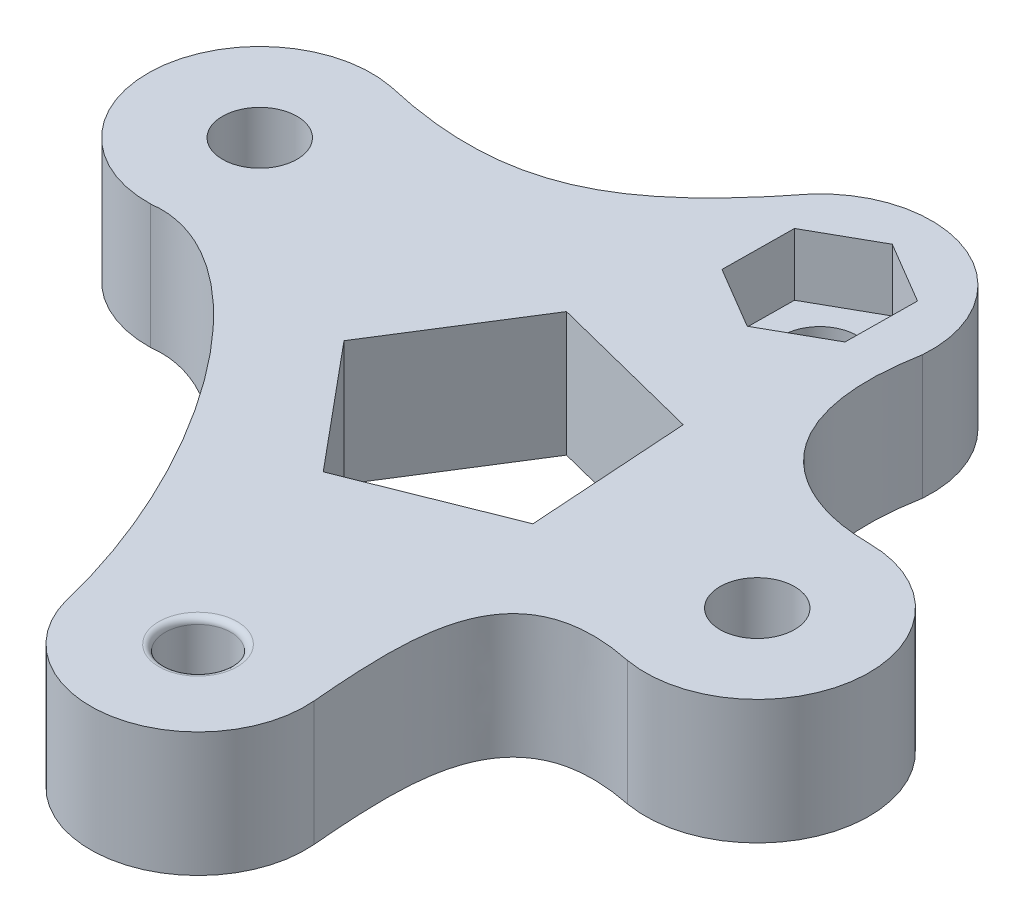
from build123d import *

# Parameters (mm, degrees)
EXTRUDE_1_OUTLINE_R   = 2.65
EXTRUDE_1_OUTLINE_R_2 = 3
EXTRUDE_1_DEPTH       = 10
CUT_EXTRUDE_1_DEPTH   = 5
FILLET_2_R            = 0.5
FILLET_3_R            = 0.5


# Read off the part's stored shape, not the designer's step: Бобышка-Вытянуть1
with BuildPart() as part:
    # Бобышка-Вытянуть1 outline → Бобышка-Вытянуть1 (new body)
    with BuildSketch(Plane(origin=(0, 0, 0), x_dir=(1, 0, 0), z_dir=(0, 1, 0))):
        with BuildLine():
            add(Edge.make_bspline(
                [(18.415201064, 16.136192912), (8.099804211, 18.278215903), (7.946140725, 9.450828153), (8.545020219, 1.48873653), (8.620156017, 0.717920777)],
                knots=[0, 0, 0, 0, 0.640184332, 0.711315924, 0.711315924, 0.711315924, 0.711315924], degree=3))
            ThreePointArc((18.415201064, 16.136192912), (28.93870742, 24.192739926), (20.02397796, 33.999866645))
            add(Edge.make_bspline(
                [(8.973177852, 49.305680737), (6.927050039, 38.283305713), (13.265956439, 34.007939827), (20.02397796, 33.999866645)],
                knots=[0, 0, 0, 0, 0.587985905, 0.587985905, 0.587985905, 0.587985905], degree=3))
            ThreePointArc((8.973177852, 49.305680737), (3.569296499, 58.26196844), (-6.656088527, 56.057762419))
            add(Edge.make_bspline(
                [(-31.086724645, 46.588079502), (-19.789574651, 43.949152129), (-13.613870041, 47.607425407), (-7.2630146, 55.254087082), (-6.656088527, 56.057762419)],
                knots=[0, 0, 0, 0, 0.709310605, 0.788122895, 0.788122895, 0.788122895, 0.788122895], degree=3))
            ThreePointArc((-31.086724645, 46.588079502), (-41.755710839, 38.490664399), (-32.559488638, 28.752856895))
            add(Edge.make_bspline(
                [(-32.559488638, 28.752856895), (-24.340075334, 29.891987935), (-11.988968241, 13.137863403), (-8.356742025, -2.233240408)],
                knots=[0, 0, 0, 0, 0.797106576, 0.797106576, 0.797106576, 0.797106576], degree=3))
            ThreePointArc((-8.356742025, -2.233240408), (1.481446867, -8.522195444), (8.620156017, 0.717920777))
        make_face()
        Circle(EXTRUDE_1_OUTLINE_R, mode=Mode.SUBTRACT)
        with Locations((19.974984355, 25)):
            Circle(EXTRUDE_1_OUTLINE_R_2, mode=Mode.SUBTRACT)
        with Locations((-32.786239492, 37.75)):
            Circle(EXTRUDE_1_OUTLINE_R_2, mode=Mode.SUBTRACT)
        Polygon((-8.349392166, 37.982099134), (4.227404243, 34.795225893), (5.082951506, 21.849183724), (-6.965087616, 17.034962885), (-15.266732554, 27.005652946), align=None, mode=Mode.SUBTRACT)
        with Locations((0, 50)):
            Circle(EXTRUDE_1_OUTLINE_R_2, mode=Mode.SUBTRACT)
    extrude(amount=EXTRUDE_1_DEPTH)

    # Эскиз2 → Вырез-Вытянуть1 (cut)
    with BuildSketch(Plane(origin=(0, 10, 0), x_dir=(1, 0, 0), z_dir=(0, 1, 0))):
        Polygon((5.030262391, 52.833689046), (0.061084495, 55.773179541), (-4.969177896, 52.939490495), (-5.030262391, 47.166310954), (-0.061084495, 44.226820459), (4.969177896, 47.060509505), align=None)
    extrude(amount=-CUT_EXTRUDE_1_DEPTH, mode=Mode.SUBTRACT)

    # Скругление2
    fillet_2_edges = [part.edges().sort_by_distance(p)[0] for p in [
        (-2.65, 0, 0),
    ]]
    fillet(fillet_2_edges, radius=FILLET_2_R)

    # Скругление3
    fillet_3_edges = [part.edges().sort_by_distance(p)[0] for p in [
        (-2.65, 10, 0),
    ]]
    fillet(fillet_3_edges, radius=FILLET_3_R)


solid = part.part
